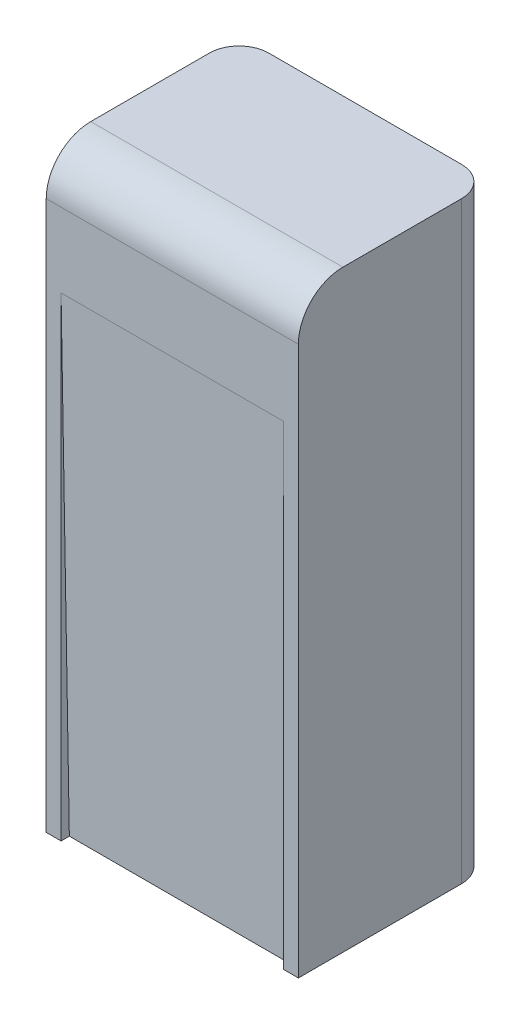
from build123d import *

# Parameters (mm, degrees)
SKETCH1_W                   = 17
SKETCH1_H                   = 13
BOSS_EXTRUDE1_DEPTH         = 40
FILLET1_R                   = 2
FILLET2_R                   = 3
M6_TAPPED_HOLE1_D           = 5
M6_TAPPED_HOLE1_DEPTH       = 17
M6_TAPPED_HOLE1_CSINK_D     = 6.05
M6_TAPPED_HOLE1_CSINK_ANGLE = 90
M6_TAPPED_HOLE1_TIP         = 1.502151548
CUT_EXTRUDE1_DEPTH          = 7.5


with BuildPart() as part:
    # Sketch1 → Boss-Extrude1 (new body)
    with BuildSketch(Plane(origin=(0, 0, 0), x_dir=(1, 0, 0), z_dir=(0, 1, 0))):
        Rectangle(SKETCH1_W, SKETCH1_H)
    extrude(amount=-BOSS_EXTRUDE1_DEPTH)

    # Fillet1
    fillet1_edges = [part.edges().sort_by_distance(p)[0] for p in [
        (-8.5, -20, -6.5),
        (8.5, -20, -6.5),
    ]]
    fillet(fillet1_edges, radius=FILLET1_R)

    # Fillet2
    fillet2_edges = [part.edges().sort_by_distance(p)[0] for p in [
        (0, 0, 6.5),
    ]]
    fillet(fillet2_edges, radius=FILLET2_R)

    # M6 Tapped Hole1
    with Locations(Plane(origin=(0, -40, 0), x_dir=(-1, 0, 0), z_dir=(0, -1, 0))):
        with Locations((-1, 0), (1, 0)):
            CounterSinkHole(M6_TAPPED_HOLE1_D / 2, M6_TAPPED_HOLE1_CSINK_D / 2, depth=M6_TAPPED_HOLE1_DEPTH, counter_sink_angle=M6_TAPPED_HOLE1_CSINK_ANGLE)
            with Locations((0, 0, -(M6_TAPPED_HOLE1_DEPTH + M6_TAPPED_HOLE1_TIP / 2))):  # 118° drill point
                Cone(0, M6_TAPPED_HOLE1_D / 2, M6_TAPPED_HOLE1_TIP, mode=Mode.SUBTRACT)

    # Sketch5 → Cut-Extrude1 (cut, symmetric)
    with BuildSketch(Plane(origin=(0, 0, 0), x_dir=(0, 0, -1), z_dir=(1, 0, 0))):
        Polygon((-6.5, -8), (-5.941437922, -40), (-6.5, -40), align=None)
    extrude(amount=CUT_EXTRUDE1_DEPTH, both=True, mode=Mode.SUBTRACT)


solid = part.part
